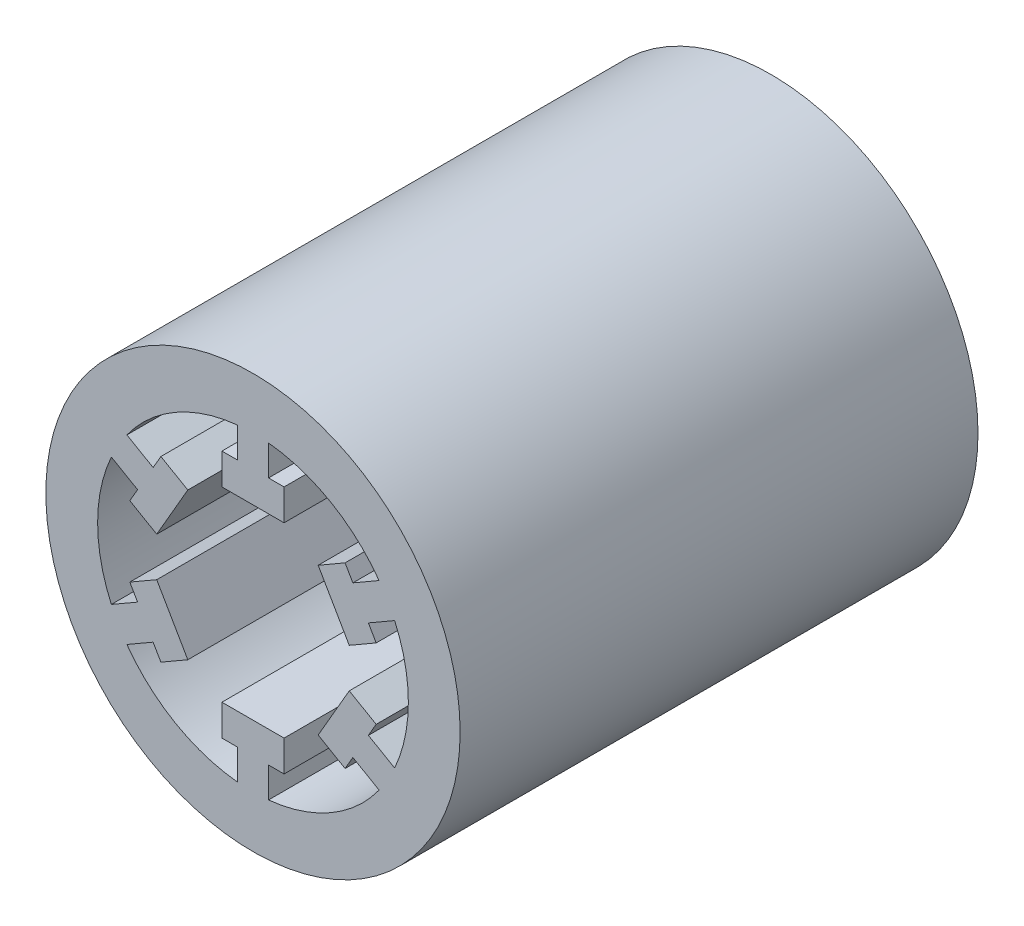
from build123d import *

# Parameters (mm, degrees)
ESBO_O1_R                = 10
RESSALTO_EXTRUS_O1_DEPTH = 12.5
CAVIDADE1_START          = -12.5
CAVIDADE1_DEPTH          = 25


# Read off the part's stored shape, not the designer's step: Cavidade1
with BuildPart() as part:
    # Esboço1 → Ressalto-extrusão1 (new, symmetric)
    with BuildSketch(Plane.XY):
        Circle(ESBO_O1_R)
    extrude(amount=RESSALTO_EXTRUS_O1_DEPTH, both=True)

    # Cavidade1 outline → Cavidade1 (cut)
    with BuildSketch(Plane.XY.offset(CAVIDADE1_START)):
        with BuildLine():
            Line((4.446152423, 4.299038106), (4.821152423, 3.649519053))
            Line((4.821152423, 3.649519053), (6.087632977, 4.380721942))
            ThreePointArc((6.087632977, 4.380721942), (3.75, 6.495190528), (0.75, 7.462405778))
            Line((0.75, 7.462405778), (0.75, 6))
            Line((0.75, 6), (1.5, 6))
            Line((1.5, 6), (1.5, 4.5))
            Line((1.5, 4.5), (-1.5, 4.5))
            Line((-1.5, 4.5), (-1.5, 6))
            Line((-1.5, 6), (-0.75, 6))
            Line((-0.75, 6), (-0.75, 7.462405778))
            ThreePointArc((-0.75, 7.462405778), (-3.75, 6.495190528), (-6.087632977, 4.380721942))
            Line((-6.087632977, 4.380721942), (-4.821152423, 3.649519053))
            Line((-4.821152423, 3.649519053), (-4.446152423, 4.299038106))
            Line((-4.446152423, 4.299038106), (-3.147114317, 3.549038106))
            Line((-3.147114317, 3.549038106), (-4.647114317, 0.950961894))
            Line((-4.647114317, 0.950961894), (-5.946152423, 1.700961894))
            Line((-5.946152423, 1.700961894), (-5.571152423, 2.350480947))
            Line((-5.571152423, 2.350480947), (-6.837632977, 3.081683836))
            ThreePointArc((-6.837632977, 3.081683836), (-7.5, 0), (-6.837632977, -3.081683836))
            Line((-6.837632977, -3.081683836), (-5.571152423, -2.350480947))
            Line((-5.571152423, -2.350480947), (-5.946152423, -1.700961894))
            Line((-5.946152423, -1.700961894), (-4.647114317, -0.950961894))
            Line((-4.647114317, -0.950961894), (-3.147114317, -3.549038106))
            Line((-3.147114317, -3.549038106), (-4.446152423, -4.299038106))
            Line((-4.446152423, -4.299038106), (-4.821152423, -3.649519053))
            Line((-4.821152423, -3.649519053), (-6.087632977, -4.380721942))
            ThreePointArc((-6.087632977, -4.380721942), (-3.75, -6.495190528), (-0.75, -7.462405778))
            Line((-0.75, -7.462405778), (-0.75, -6))
            Line((-0.75, -6), (-1.5, -6))
            Line((-1.5, -6), (-1.5, -4.5))
            Line((-1.5, -4.5), (1.5, -4.5))
            Line((1.5, -4.5), (1.5, -6))
            Line((1.5, -6), (0.75, -6))
            Line((0.75, -6), (0.75, -7.462405778))
            ThreePointArc((0.75, -7.462405778), (3.75, -6.495190528), (6.087632977, -4.380721942))
            Line((6.087632977, -4.380721942), (4.821152423, -3.649519053))
            Line((4.821152423, -3.649519053), (4.446152423, -4.299038106))
            Line((4.446152423, -4.299038106), (3.147114317, -3.549038106))
            Line((3.147114317, -3.549038106), (4.647114317, -0.950961894))
            Line((4.647114317, -0.950961894), (5.946152423, -1.700961894))
            Line((5.946152423, -1.700961894), (5.571152423, -2.350480947))
            Line((5.571152423, -2.350480947), (6.837632977, -3.081683836))
            ThreePointArc((6.837632977, -3.081683836), (7.5, 0), (6.837632977, 3.081683836))
            Line((6.837632977, 3.081683836), (5.571152423, 2.350480947))
            Line((5.571152423, 2.350480947), (5.946152423, 1.700961894))
            Line((5.946152423, 1.700961894), (4.647114317, 0.950961894))
            Line((4.647114317, 0.950961894), (3.147114317, 3.549038106))
            Line((3.147114317, 3.549038106), (4.446152423, 4.299038106))
        make_face()
    extrude(amount=CAVIDADE1_DEPTH, mode=Mode.SUBTRACT)


solid = part.part
